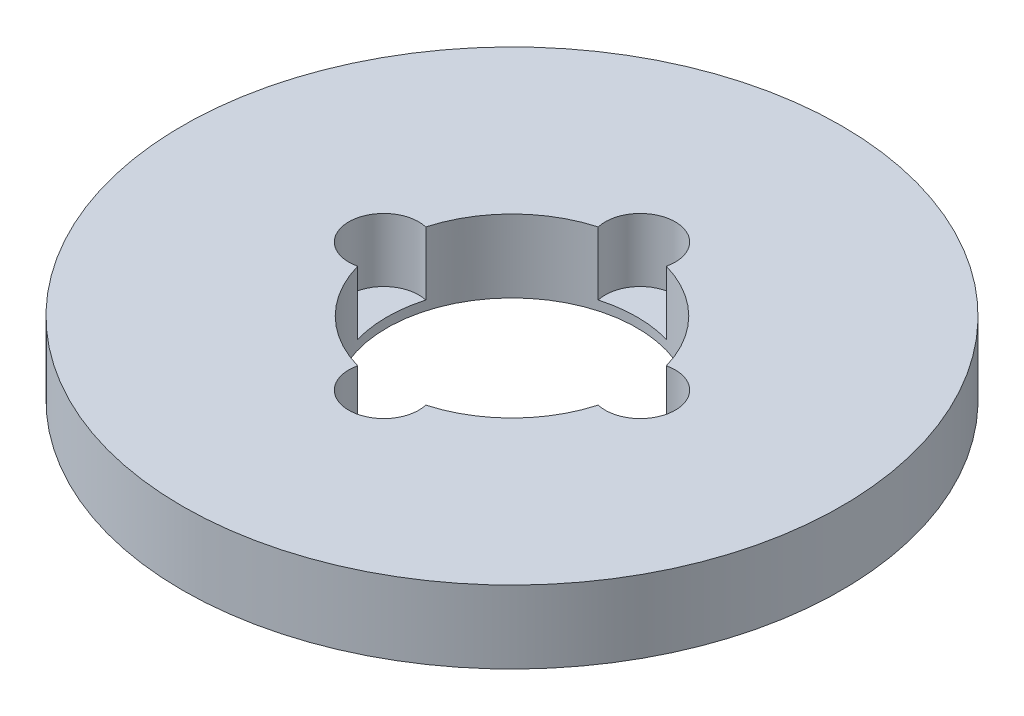
from build123d import *

# Parameters (mm, degrees)
SKETCH1_R           = 72.5
BOSS_EXTRUDE1_DEPTH = 16
SKETCH2_R           = 27.5
CUT_EXTRUDE1_DEPTH  = 104.771383339
SKETCH3_R           = 7.693568854
CUT_EXTRUDE2_DEPTH  = 13.928717956
CIRPATTERN1_COUNT   = 4


with BuildPart() as part:
    # Sketch1 → Boss-Extrude1 (new body)
    with BuildSketch(Plane(origin=(0, 0, 0), x_dir=(1, 0, 0), z_dir=(0, 1, 0))):
        Circle(SKETCH1_R)
    extrude(amount=BOSS_EXTRUDE1_DEPTH)

    # Sketch2 → Cut-Extrude1 (cut, through all)
    with BuildSketch(Plane(origin=(0, 0, 0), x_dir=(1, 0, 0), z_dir=(0, 1, 0))):
        Circle(SKETCH2_R)
    extrude(amount=CUT_EXTRUDE1_DEPTH, mode=Mode.SUBTRACT)

    # Sketch3 → Cut-Extrude2 (cut)
    with BuildSketch(Plane(origin=(0, 16, 0), x_dir=(1, 0, 0), z_dir=(0, 1, 0))):
        with Locations((-28.211943012, 0)):
            Circle(SKETCH3_R)
    cut_extrude2 = extrude(amount=-CUT_EXTRUDE2_DEPTH, mode=Mode.SUBTRACT)

    # CirPattern1: Cut-Extrude2 ×4 about axis
    cirpattern1_axis = Axis((0, 0, 0), (0, 1, 0))
    for i in range(1, CIRPATTERN1_COUNT):
        add(cut_extrude2.rotate(cirpattern1_axis, i * 360 / CIRPATTERN1_COUNT), mode=Mode.SUBTRACT)


solid = part.part
